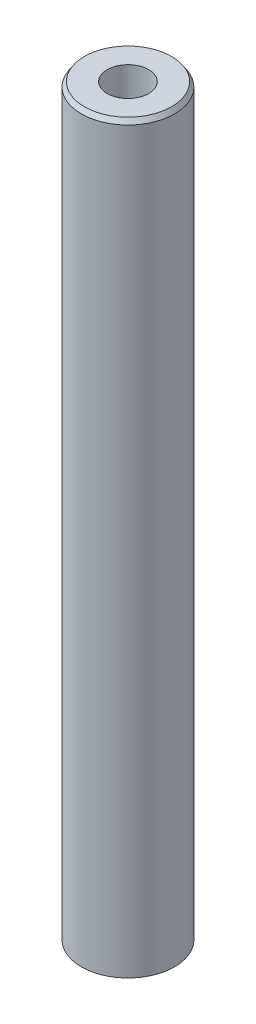
from build123d import *
from OCP.BRepFilletAPI import BRepFilletAPI_MakeChamfer

# Parameters (mm, degrees)
SKETCH1_R           = 37.5
BOSS_EXTRUDE1_DEPTH = 600
SKETCH2_R           = 16.676313324
CUT_EXTRUDE1_DEPTH  = 603.339190158
CHAMFER1_SIZE       = 3.75500311
CHAMFER1_SIZE2      = 2.456072486


with BuildPart() as part:
    # Sketch1 → Boss-Extrude1 (new body)
    with BuildSketch(Plane(origin=(0, 0, 0), x_dir=(1, 0, 0), z_dir=(0, 1, 0))):
        Circle(SKETCH1_R)
    extrude(amount=BOSS_EXTRUDE1_DEPTH)

    # Sketch2 → Cut-Extrude1 (cut, through all)
    with BuildSketch(Plane(origin=(0, 0, 0), x_dir=(1, 0, 0), z_dir=(0, 1, 0))):
        Circle(SKETCH2_R)
    extrude(amount=CUT_EXTRUDE1_DEPTH, mode=Mode.SUBTRACT)

    # Chamfer1: one chamfer whose edges measure the first distance from different faces: ONE call of the kernel's chamfer builder (chamfer() names one face for all edges)
    chamfer1_edges_1 = [part.edges().sort_by_distance(p)[0] for p in [
        (-37.5, 600, 0),
    ]]
    chamfer1_side_1 = [part.faces().sort_by_distance(p)[0] for p in [
        (-37.5, 300, 0),
    ]]
    chamfer1_edges_2 = [part.edges().sort_by_distance(p)[0] for p in [
        (-37.5, 0, 0),
    ]]
    chamfer1_side_2 = [part.faces().sort_by_distance(p)[0] for p in [
        (-36.439339828, 0, 0),
    ]]
    chamfer1 = BRepFilletAPI_MakeChamfer(part.part.solid().wrapped)
    for e in chamfer1_edges_1:
        chamfer1.Add(CHAMFER1_SIZE, CHAMFER1_SIZE2, e.wrapped, chamfer1_side_1[0].wrapped)  # the first distance lies on this face
    for e in chamfer1_edges_2:
        chamfer1.Add(CHAMFER1_SIZE, CHAMFER1_SIZE2, e.wrapped, chamfer1_side_2[0].wrapped)  # the first distance lies on this face
    add(Compound.cast(chamfer1.Shape()), mode=Mode.REPLACE)


solid = part.part
